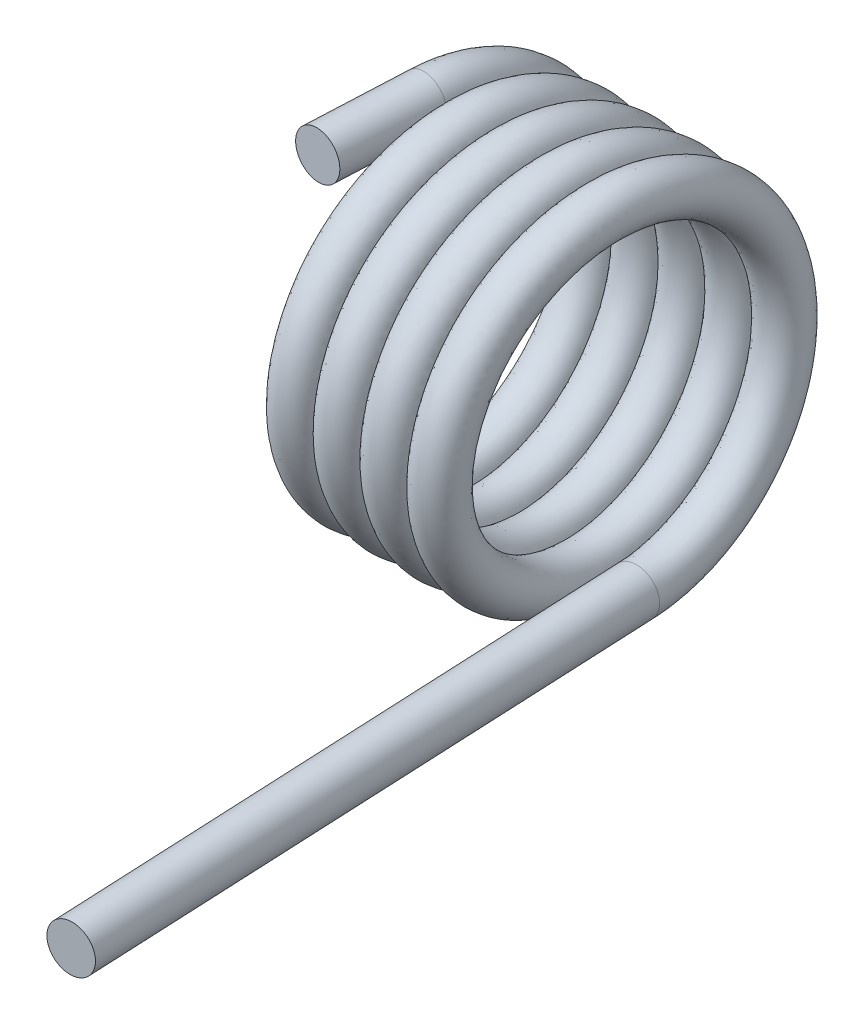
from build123d import *

# Parameters (mm, degrees)
SWEEP1_PITCH   = 3.2004
SKETCH4_R      = 1.5875
EXTRUDE1_DEPTH = 40.5
SKETCH5_R      = 1.5875
EXTRUDE2_DEPTH = 7


with BuildPart() as part:
    # Sweep1: arcs per turn and ends read off the stored shape
    # Sweep1: the profile of Sketch3 screwed along a left-hand helix through 4.5 turns, 6 arcs to a turn; built about Z, then put on its axis
    sweep1_z = Axis((0, 0, 0), (0, 0, 1))
    sweep1_corners = [(11.009687355, -0.07359291, -1.585364203), (12.559871382, 0.001710476, 0.036847676), (10.935912645, 0.07359291, 1.585364203), (9.385728618, -0.001710476, -0.036847676)]
    with BuildLine(mode=Mode.PRIVATE) as sweep1_profile:
        ThreePointArc((11.009687355, -0.07359291, -1.585364203), (12.121112236, -0.050828557, -1.094966537), (12.559871382, 0.001710476, 0.036847676))
        ThreePointArc((12.559871382, 0.001710476, 0.036847676), (12.068945638, 0.053247535, 1.14707702), (10.935912645, 0.07359291, 1.585364203))
        ThreePointArc((10.935912645, 0.07359291, 1.585364203), (9.824487764, 0.050828557, 1.094966537), (9.385728618, -0.001710476, -0.036847676))
        ThreePointArc((9.385728618, -0.001710476, -0.036847676), (9.876654362, -0.053247535, -1.14707702), (11.009687355, -0.07359291, -1.585364203))
    sweep1_cap = Face(sweep1_profile.wire())
    sweep1_arcs = [((11.009687355, -0.07359291, -1.585364203), (12.596758737, -0.071882434, -1.548516527), (12.559871382, 0.001710476, 0.036847676), (1, 0.7071067811865476, 1)), ((12.559871382, 0.001710476, 0.036847676), (12.522984028, 0.075303386, 1.622211879), (10.935912645, 0.07359291, 1.585364203), (1, 0.7071067811865476, 1)), ((10.935912645, 0.07359291, 1.585364203), (9.348841263, 0.071882434, 1.548516527), (9.385728618, -0.001710476, -0.036847676), (1, 0.7071067811865476, 1)), ((9.385728618, -0.001710476, -0.036847676), (9.422615972, -0.075303386, -1.622211879), (11.009687355, -0.07359291, -1.585364203), (1, 0.7071067811865476, 1))]  # start, shoulder, end, weights
    sweep1_turn_angles = [0, -30, -60, -90, -120, -150, -180, -210, -240, -270, -300, -330, -360]
    sweep1_turn_weights = [1, 0.8660254037844387, 1, 0.8660254037844387, 1, 0.8660254037844387, 1, 0.8660254037844387, 1, 0.8660254037844387, 1, 0.8660254037844387, 1]
    sweep1_turn_sides = [Face.make_bezier_surface([[Vector(p[j][0], p[j][1], 0).rotate(sweep1_z, sweep1_turn_angles[2 * i + k]) / sweep1_turn_weights[2 * i + k] + Vector(0, 0, p[j][2] + -SWEEP1_PITCH * sweep1_turn_angles[2 * i + k] / 360) for k in range(3)] for j in range(3)], [[p[3][j] * sweep1_turn_weights[2 * i + k] for k in range(3)] for j in range(3)]) for p in sweep1_arcs for i in range(6)]
    sweep1_last_angles = [-1440, -1470, -1500, -1530, -1560, -1590, -1620]
    sweep1_last_weights = [1, 0.8660254037844387, 1, 0.8660254037844387, 1, 0.8660254037844277, 1]
    sweep1_last_sides = [Face.make_bezier_surface([[Vector(p[j][0], p[j][1], 0).rotate(sweep1_z, sweep1_last_angles[2 * i + k]) / sweep1_last_weights[2 * i + k] + Vector(0, 0, p[j][2] + -SWEEP1_PITCH * sweep1_last_angles[2 * i + k] / 360) for k in range(3)] for j in range(3)], [[p[3][j] * sweep1_last_weights[2 * i + k] for k in range(3)] for j in range(3)]) for p in sweep1_arcs for i in range(3)]
    sweep1 = Plane(origin=(0, 0, 0), x_dir=(0, -1, 0), z_dir=(-1, 0, 0)) * Solid(Shell([*[p.moved(Location((0, 0, SWEEP1_PITCH * i))) for i in range(4) for p in sweep1_turn_sides], *sweep1_last_sides, sweep1_cap, sweep1_cap.rotate(sweep1_z, -1620).moved(Location((0, 0, -SWEEP1_PITCH * -1620 / 360)))]))
    add(sweep1)

    # Sketch4 → Extrude1 (add)
    with BuildSketch(Plane(origin=(0, 0, 0), x_dir=(-0.9986546161521215, 0.02323612909274775, 0.046357738758960446), z_dir=(0.04637025851064802, -1.0927456856046902e-14, 0.9989243210201941))):
        with Locations(Location((-0.254965397, 10.969837396, 0), (0, 0, 1.33145196))):
            Circle(SKETCH4_R)
    extrude(amount=EXTRUDE1_DEPTH)

    # Sketch5 → Extrude2 (add)
    with BuildSketch(Plane(origin=(-0.030966763, 0, 0.667096834), x_dir=(0.9921764042832011, 0.11603763954719476, 0.04605701892191221), z_dir=(-0.046370258510648014, -7.017129932673782e-14, 0.9989243210201941))):
        with Locations(Location((-13.015868328, 12.568029982, 0), (0, 0, 173.336521883))):
            Circle(SKETCH5_R)
    extrude(amount=EXTRUDE2_DEPTH)


solid = part.part
